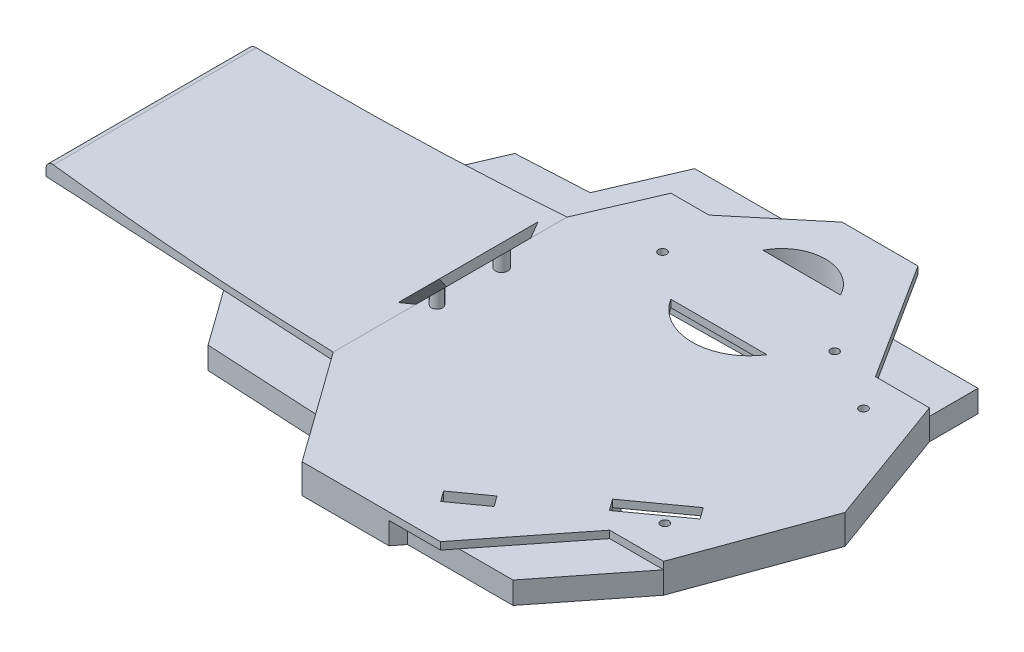
from build123d import *

# Parameters (mm, degrees)
EXTRUDE_1_DEPTH               = 2
EXTRUDE_2_DEPTH               = 2
CUT_EXTRUDE_3_DEPTH           = 202.869395429
CUT_EXTRUDE_3_DEPTH_BACK      = 202.869395429
FILLET_1_R                    = 2
EXTRUDE_4_DEPTH               = 6
CUT_EXTRUDE_7_DEPTH           = 202.98824919
EXTRUDE_5_DEPTH               = 2
EXTRUDE_5_DRAFT               = -45
EXTRUDE_11_REACH              = 204.137
SKETCH_24_R                   = 1.697293379
SKETCH_24_R_2                 = 1.5
CUT_EXTRUDE_8_DEPTH           = 203.13682253
SKETCH_26_W                   = 1.1303
SKETCH_26_H                   = 10
HOLE_WIZARD_4_40_3_AT_2_COUNT = 2
HOLE_WIZARD_4_40_3_AT_2_PITCH = 54.095245987
SKETCH_29_R                   = 3
EXTRUDE_14_DEPTH              = 5
SKETCH_32_W                   = 1.1303
SKETCH_32_H                   = 8
HOLE_WIZARD_4_40_4_AT_2_COUNT = 2
HOLE_WIZARD_4_40_4_AT_2_PITCH = 46.853089657
SKETCH_35_W                   = 1.1303
SKETCH_35_H                   = 6
HOLE_WIZARD_4_40_5_AT_2_COUNT = 2
HOLE_WIZARD_4_40_5_AT_2_PITCH = 67.324981434


with BuildPart() as part:
    # 草图2 → 凸台-拉伸1 (new body)
    with BuildSketch(Plane(origin=(0, 0, 0), x_dir=(1, 0, 0), z_dir=(0, 1, 0))):
        Polygon((141.821582241, 68.082690978), (121.161879345, 68.082690978), (101.35099463, 51.608897425), (91.039832206, 51.608897425), (82.527346571, 31.825074964), (0, 27.5), (0, -27.5), (82.527346571, -31.825074964), (104.14664553, -61.917309022), (141.821582241, -61.917309022), (162.133732132, -36.18552755), (176.829545061, -36.18552755), (190, 0), (176.829545061, 36.18552755), (162.133732132, 36.18552755), align=None)
    extrude(amount=EXTRUDE_1_DEPTH)

    # 草图6 → 凸台-拉伸2 (add)
    with BuildSketch(Plane(origin=(0, 2, 0), x_dir=(1, 0, 0), z_dir=(0, 1, 0))):
        Polygon((82.527346571, 31.825074964), (82.527346571, -31.825074964), (0, -27.5), (0, 27.5), align=None)
    extrude(amount=EXTRUDE_2_DEPTH)

    # 草图7 → 切除-拉伸3 (cut, two sides: drawn at the far end of the back side and taken through both)
    with BuildSketch(Plane.XY.offset(-CUT_EXTRUDE_3_DEPTH_BACK)):
        with BuildLine():
            Line((82.527346571, 2), (82.527346571, 30.740821148))
            Line((82.527346571, 30.740821148), (0, 4))
            add(Edge.make_bspline(
                [(82.527346571, 2), (41.215261335, 1.001172546), (0, 4)],
                knots=[0, 0, 0, 1, 1, 1], degree=2))
        make_face()
    extrude(amount=CUT_EXTRUDE_3_DEPTH + CUT_EXTRUDE_3_DEPTH_BACK, mode=Mode.SUBTRACT)

    # 圆角1
    fillet_1_edges = [part.edges().sort_by_distance(p)[0] for p in [
        (0, 4, 13.75),
    ]]
    fillet(fillet_1_edges, radius=FILLET_1_R)

    # 草图13 → 凸台-拉伸4 (add)
    with BuildSketch(Plane.XZ):
        Polygon((53.501507434, -30.303895193), (58.412275987, -41.716986195), (77.926898746, -42.739704237), (86.484415452, -62.62818317), (136.164724768, -62.62818317), (144.584081331, -49.40685536), (176.829545061, -49.40685536), (176.829545061, -36.18552755), (190, 0), (176.829545061, 36.18552755), (158.743204348, 59.097615602), (130.016377906, 59.097615602), (127.790568727, 61.917309022), (104.14664553, 61.917309022), (93.336996051, 46.871191993), (61.845926158, 45.220814953), (51.036276678, 30.174697924), (171.852914921, 31.825074964), (171.852914921, -31.825074964), align=None)
    extrude(amount=EXTRUDE_4_DEPTH)

    # 草图18 → 切除-拉伸7 (cut, through all)
    with BuildSketch(Plane(origin=(0, 2, 0), x_dir=(1, 0, 0), z_dir=(0, 1, 0))):
        Polygon((169.563862496, -18.125868021), (155.218286362, -28.471875769), (157.463858458, -31.585543016), (171.809434591, -21.239535267), align=None)
        Polygon((130.302091903, -49.564637909), (132.361562224, -52.420260001), (140.814695434, -46.323873151), (138.755225113, -43.468251059), align=None)
    extrude(amount=-CUT_EXTRUDE_7_DEPTH, mode=Mode.SUBTRACT)

    # 草图17 → 切除-拉伸8 (cut, through all)
    with BuildSketch(Plane(origin=(0, 2, 0), x_dir=(1, 0, 0), z_dir=(0, 1, 0))):
        with BuildLine():
            Line((142.181150975, 26.59529287), (116.011181983, 26.59529287))
            ThreePointArc((116.011181983, 26.59529287), (129.096166479, 19.355270398), (142.181150975, 26.59529287))
        make_face()
        with BuildLine():
            Line((116.98958299, 50.681307574), (138.127410429, 50.681307574))
            ThreePointArc((138.127410429, 50.681307574), (127.55849671, 57.129732827), (116.98958299, 50.681307574))
        make_face()
    extrude(amount=-CUT_EXTRUDE_8_DEPTH, mode=Mode.SUBTRACT)

    # 草图26 → #4-40 螺纹孔3 (revolve, cut)
    with BuildSketch(Plane(origin=(168.015540482, 4, 27.047622993), x_dir=(0, 0, 1), z_dir=(1, 0, 0))):
        with Locations((0.56515, 5)):
            Rectangle(SKETCH_26_W, SKETCH_26_H)
    hole_wizard_4_40_3 = revolve(axis=Axis((168.015540482, 10.35, 27.047622993), (0, -1, 0)), mode=Mode.SUBTRACT)

    # #4-40 螺纹孔3 at 2: #4-40 螺纹孔3 ×2
    with Locations(*[(0, 0, -i * HOLE_WIZARD_4_40_3_AT_2_PITCH) for i in range(1, HOLE_WIZARD_4_40_3_AT_2_COUNT)]):
        add(hole_wizard_4_40_3, mode=Mode.SUBTRACT)

    # 草图29 → 凸台-拉伸14 (add)
    with BuildSketch(Plane.XZ):
        with Locations((67.061317629, 25.566411224)):
            Circle(SKETCH_29_R)
        with Locations((67.061317629, -25.566411224)):
            Circle(SKETCH_29_R)
        with Locations((150.788762168, 25.939901438)):
            Circle(SKETCH_29_R)
        with Locations((150.788762168, -25.939901438)):
            Circle(SKETCH_29_R)
    extrude(amount=EXTRUDE_14_DEPTH)

    # 草图32 → #4-40 螺纹孔4 (revolve, cut)
    with BuildSketch(Plane(origin=(150.602455899, 2, -36.6082143), x_dir=(0, 0, 1), z_dir=(1, 0, 0))):
        with Locations((0.56515, 4)):
            Rectangle(SKETCH_32_W, SKETCH_32_H)
    hole_wizard_4_40_4 = revolve(axis=Axis((150.602455899, 8.35, -36.6082143), (0, -1, 0)), mode=Mode.SUBTRACT)

    # #4-40 螺纹孔4 at 2: #4-40 螺纹孔4 ×2
    with Locations(*[(-i * HOLE_WIZARD_4_40_4_AT_2_PITCH, 0, 0) for i in range(1, HOLE_WIZARD_4_40_4_AT_2_COUNT)]):
        add(hole_wizard_4_40_4, mode=Mode.SUBTRACT)

    # 草图35 → #4-40 螺纹孔5 (revolve, cut)
    with BuildSketch(Plane(origin=(176.735584933, 0, 15.639737001), x_dir=(0, 0, 1), z_dir=(1, 0, 0))):
        with Locations((0.56515, 3)):
            Rectangle(SKETCH_35_W, SKETCH_35_H)
    hole_wizard_4_40_5 = revolve(axis=Axis((176.735584933, 6.35, 15.639737001), (0, -1, 0)), mode=Mode.SUBTRACT)

    # #4-40 螺纹孔5 at 2: #4-40 螺纹孔5 ×2
    with Locations(*[Vector(-0.8103060721730659, 0, 0.5860068851126735) * (i * HOLE_WIZARD_4_40_5_AT_2_PITCH) for i in range(1, HOLE_WIZARD_4_40_5_AT_2_COUNT)]):
        add(hole_wizard_4_40_5, mode=Mode.SUBTRACT)


with BuildPart() as body_2:
    # 草图23 → 凸台-拉伸5 (with draft: the straight prism first)
    with BuildSketch(Plane(origin=(40.263673286, -40.263673286, 0), x_dir=(0, 0, -1), z_dir=(-0.7071067811865488, 0.7071067811865464, 0))):
        Polygon((-9.292036768, -59.769859956), (-9.292036768, -60.809778756), (-9.292036768, -71.520555916), (13.638077716, -71.520555916), (13.638077716, -59.769859956), align=None)
    extrude(amount=EXTRUDE_5_DEPTH)
    # 凸台-拉伸5: the draft: its side faces are tilted about the plane it starts from
    extrude_5_sides = [body_2.faces().sort_by_distance(p)[0] for p in [
        (85.974738189, 6.86160518, 9.292036768),
        (85.974738189, 6.86160518, -13.638077716),
        (90.129236587, 11.016103578, -2.173020474),
        (81.82023979, 2.707106781, -2.173020474),
    ]]
    draft(extrude_5_sides, Plane(origin=(40.263673286, -40.263673286, 0), x_dir=(0, 0, -1), z_dir=(-0.7071067811865488, 0.7071067811865464, 0)), EXTRUDE_5_DRAFT)


with BuildPart() as body_3:
    # 凸台-拉伸11: up to this plane
    extrude_11_end = Plane(origin=(40.263673286, -40.263673286, 0), z_dir=(0.7071067811865476, -0.7071067811865476, 0))
    # 草图24 → 凸台-拉伸11 (new, up to the surface)
    with BuildSketch(Plane(origin=(0, 2, 0), x_dir=(1, 0, 0), z_dir=(0, 1, 0)), mode=Mode.PRIVATE) as extrude_11_sk1:
        with Locations((85.490261725, 11.047785882)):
            Circle(SKETCH_24_R)
    extrude_11_tool1 = split(extrude(extrude_11_sk1.sketch, amount=EXTRUDE_11_REACH, mode=Mode.PRIVATE), bisect_by=extrude_11_end, keep=Keep.BOTH, mode=Mode.PRIVATE)
    add(extrude_11_tool1.solids().sort_by_distance((85.490262, 2, -11.047786))[0])
    # 草图24 → 凸台-拉伸11 (new, up to the surface)
    with BuildSketch(Plane(origin=(0, 2, 0), x_dir=(1, 0, 0), z_dir=(0, 1, 0)), mode=Mode.PRIVATE) as extrude_11_sk2:
        with Locations((85.490261725, -6.54134788)):
            Circle(SKETCH_24_R_2)
    extrude_11_tool2 = split(extrude(extrude_11_sk2.sketch, amount=EXTRUDE_11_REACH, mode=Mode.PRIVATE), bisect_by=extrude_11_end, keep=Keep.BOTH, mode=Mode.PRIVATE)
    add(extrude_11_tool2.solids().sort_by_distance((85.490262, 2, 6.541348))[0])


solid = Compound([part.part, body_2.part, body_3.part])
